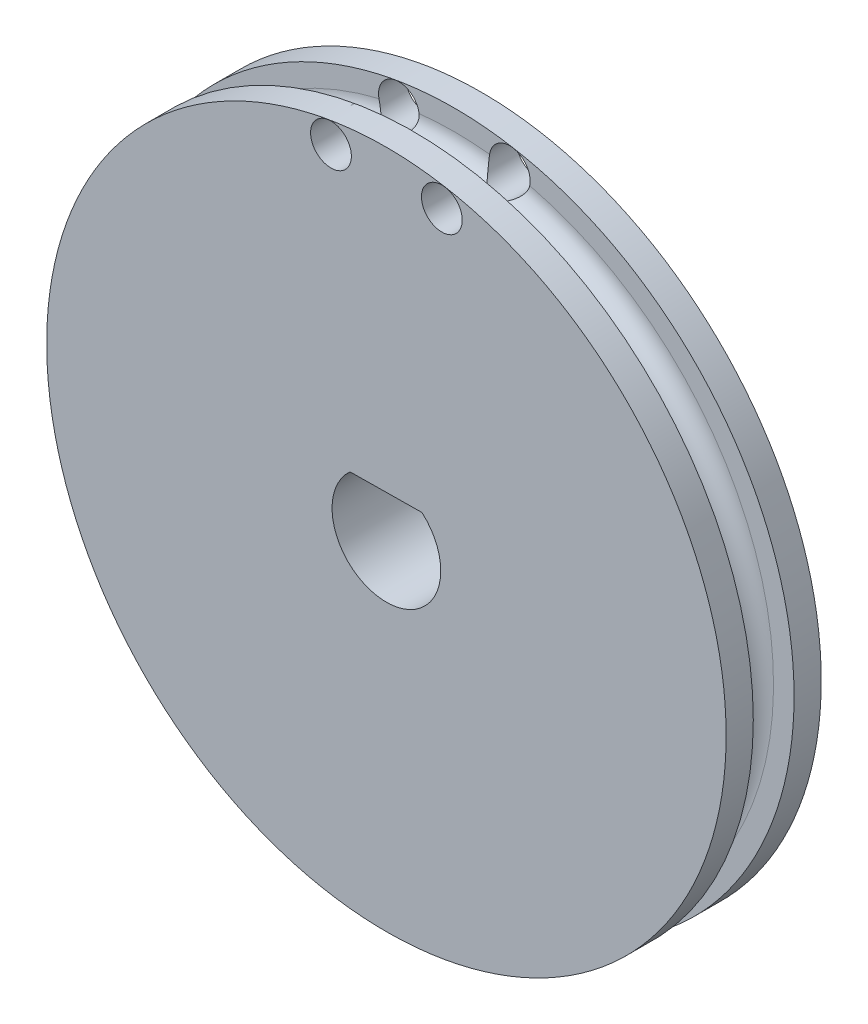
from build123d import *
from OCP.BRepAlgoAPI import BRepAlgoAPI_Cut
from OCP.TopTools import TopTools_ListOfShape

# Parameters (mm, degrees)
CUT_EXTRUDE1_DEPTH  = 9
SKETCH4_R           = 1.5
CUT_EXTRUDE10_DEPTH = 33.49


with BuildPart() as part:
    # Sketch2 → Revolve1 (revolve)
    with BuildSketch(Plane(origin=(0, 0, 0), x_dir=(0, 0, -1), z_dir=(1, 0, 0))):
        with BuildLine():
            Line((-3.572036915, 0), (3.427963085, 0))
            Line((3.427963085, 0), (3.427963085, 25))
            Line((3.427963085, 25), (1.427963085, 25))
            Line((1.427963085, 25), (1.427963085, 23.49))
            ThreePointArc((1.427963085, 23.49), (-0.072036915, 21.99), (-1.572036915, 23.49))
            Line((-1.572036915, 23.49), (-1.572036915, 25))
            Line((-1.572036915, 25), (-3.572036915, 25))
            Line((-3.572036915, 25), (-3.572036915, 0))
        make_face()
    revolve(axis=Axis((0, 0, 3.572036915), (0, 0, -1)))

    # Sketch3 → Cut-Extrude1 (cut)
    with BuildSketch(Plane(origin=(0, 0, -3.427963085), x_dir=(-1, 0, 0), z_dir=(0, 0, -1))):
        with BuildLine():
            Line((-2.613191437, 3.028403955), (2.678002471, 2.971245996))
            ThreePointArc((2.678002471, 2.971245996), (-0.043207356, -3.999766634), (-2.613191437, 3.028403955))
        make_face()
    extrude(amount=-CUT_EXTRUDE1_DEPTH, mode=Mode.SUBTRACT)


with BuildPart() as cut_extrude10_tool:
    # Sketch4 → Cut-Extrude10 (new body)
    with BuildSketch(Plane(origin=(0, 0, -3.427963085), x_dir=(-1, 0, 0), z_dir=(0, 0, -1))):
        with Locations((-4.078995693, 23.133134118)):
            Circle(SKETCH4_R)
        with Locations((4.078995693, 23.133134118)):
            Circle(SKETCH4_R)
    extrude(amount=-CUT_EXTRUDE10_DEPTH)


with BuildPart() as part_1:
    add(part.part)

    # Cut-Extrude10: cut by cut_extrude10_tool, with a tolerance
    cut_extrude10_stock = TopTools_ListOfShape()
    cut_extrude10_stock.Append(part_1.part.wrapped)
    cut_extrude10_tools = TopTools_ListOfShape()
    cut_extrude10_tools.Append(cut_extrude10_tool.part.wrapped)
    cut_extrude10_cut = BRepAlgoAPI_Cut()
    cut_extrude10_cut.SetArguments(cut_extrude10_stock)
    cut_extrude10_cut.SetTools(cut_extrude10_tools)
    cut_extrude10_cut.SetFuzzyValue(0.00001)
    cut_extrude10_cut.Build()
    add(Compound.cast(cut_extrude10_cut.Shape()).solids(), mode=Mode.REPLACE)


solid = part_1.part
